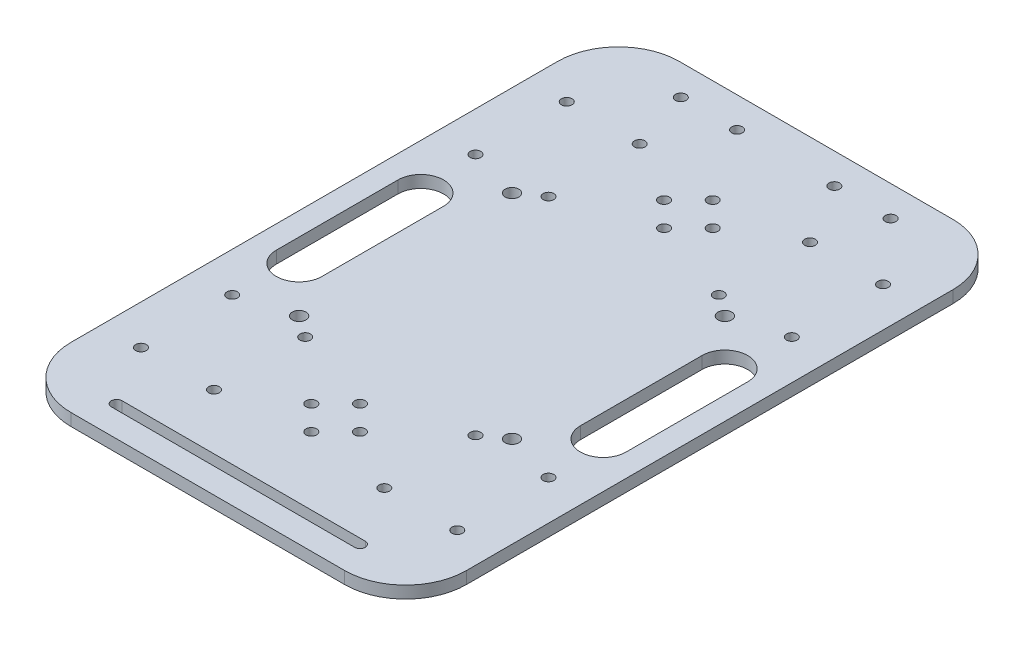
from build123d import *

# Parameters (mm, degrees)
SKETCH_1_W      = 130
SKETCH_1_H      = 200
SKETCH_1_R      = 1.75
SKETCH_1_R_2    = 2.25
EXTRUDE_2_DEPTH = 4
FILLET_1_R      = 20
FILLET_2_R      = 20
FILLET_3_R      = 20
FILLET_4_R      = 20


with BuildPart() as part:
    # 草图1 → 凸台-拉伸2 (new body)
    with BuildSketch(Plane(origin=(0, 0, 0), x_dir=(1, 0, 0), z_dir=(0, 1, 0))):
        Rectangle(SKETCH_1_W, SKETCH_1_H)
        with Locations((-52, -70)):
            Circle(SKETCH_1_R, mode=Mode.SUBTRACT)
        with Locations((-28, -70)):
            Circle(SKETCH_1_R, mode=Mode.SUBTRACT)
        with Locations((-8, -58)):
            Circle(SKETCH_1_R, mode=Mode.SUBTRACT)
        with Locations((0, -50)):
            Circle(SKETCH_1_R, mode=Mode.SUBTRACT)
        with Locations((-52, -40)):
            Circle(SKETCH_1_R, mode=Mode.SUBTRACT)
        with Locations((-35, -35)):
            Circle(SKETCH_1_R_2, mode=Mode.SUBTRACT)
        with BuildLine():
            ThreePointArc((-42.5, -20), (-50, -27.5), (-57.5, -20))
            Line((-57.5, -20), (-57.5, 20))
            ThreePointArc((-57.5, 20), (-50, 27.5), (-42.5, 20))
            Line((-42.5, 20), (-42.5, -20))
        make_face(mode=Mode.SUBTRACT)
        with Locations((-28, -40)):
            Circle(SKETCH_1_R, mode=Mode.SUBTRACT)
        with BuildLine():
            ThreePointArc((-40, -91.75), (-41.75, -90), (-40, -88.25))
            Line((-40, -88.25), (40, -88.25))
            ThreePointArc((40, -88.25), (41.75, -90), (40, -91.75))
            Line((40, -91.75), (-40, -91.75))
        make_face(mode=Mode.SUBTRACT)
        with Locations((0, -66)):
            Circle(SKETCH_1_R, mode=Mode.SUBTRACT)
        with Locations((8, -58)):
            Circle(SKETCH_1_R, mode=Mode.SUBTRACT)
        with Locations((28, -70)):
            Circle(SKETCH_1_R, mode=Mode.SUBTRACT)
        with Locations((52, -70)):
            Circle(SKETCH_1_R, mode=Mode.SUBTRACT)
        with Locations((28, -40)):
            Circle(SKETCH_1_R, mode=Mode.SUBTRACT)
        with Locations((35, -35)):
            Circle(SKETCH_1_R_2, mode=Mode.SUBTRACT)
        with Locations((52, -40)):
            Circle(SKETCH_1_R, mode=Mode.SUBTRACT)
        with BuildLine():
            ThreePointArc((57.5, -20), (50, -27.5), (42.5, -20))
            Line((42.5, -20), (42.5, 20))
            ThreePointArc((42.5, 20), (50, 27.5), (57.5, 20))
            Line((57.5, 20), (57.5, -20))
        make_face(mode=Mode.SUBTRACT)
        with Locations((-52, 40)):
            Circle(SKETCH_1_R, mode=Mode.SUBTRACT)
        with Locations((-35, 35)):
            Circle(SKETCH_1_R_2, mode=Mode.SUBTRACT)
        with Locations((-28, 40)):
            Circle(SKETCH_1_R, mode=Mode.SUBTRACT)
        with Locations((0, 50)):
            Circle(SKETCH_1_R, mode=Mode.SUBTRACT)
        with Locations((-52, 70)):
            Circle(SKETCH_1_R, mode=Mode.SUBTRACT)
        with Locations((-34.5, 90)):
            Circle(SKETCH_1_R, mode=Mode.SUBTRACT)
        with Locations((-28, 70)):
            Circle(SKETCH_1_R, mode=Mode.SUBTRACT)
        with Locations((-8, 58)):
            Circle(SKETCH_1_R, mode=Mode.SUBTRACT)
        with Locations((0, 66)):
            Circle(SKETCH_1_R, mode=Mode.SUBTRACT)
        with Locations((-16, 90)):
            Circle(SKETCH_1_R, mode=Mode.SUBTRACT)
        with Locations((28, 40)):
            Circle(SKETCH_1_R, mode=Mode.SUBTRACT)
        with Locations((35, 35)):
            Circle(SKETCH_1_R_2, mode=Mode.SUBTRACT)
        with Locations((52, 40)):
            Circle(SKETCH_1_R, mode=Mode.SUBTRACT)
        with Locations((8, 58)):
            Circle(SKETCH_1_R, mode=Mode.SUBTRACT)
        with Locations((28, 70)):
            Circle(SKETCH_1_R, mode=Mode.SUBTRACT)
        with Locations((16, 90)):
            Circle(SKETCH_1_R, mode=Mode.SUBTRACT)
        with Locations((52, 70)):
            Circle(SKETCH_1_R, mode=Mode.SUBTRACT)
        with Locations((34.5, 90)):
            Circle(SKETCH_1_R, mode=Mode.SUBTRACT)
    extrude(amount=EXTRUDE_2_DEPTH)

    # 圆角1
    fillet_1_edges = [part.edges().sort_by_distance(p)[0] for p in [
        (65, 2, 100),
    ]]
    fillet(fillet_1_edges, radius=FILLET_1_R)

    # 圆角2
    fillet_2_edges = [part.edges().sort_by_distance(p)[0] for p in [
        (-65, 2, 100),
    ]]
    fillet(fillet_2_edges, radius=FILLET_2_R)

    # 圆角3
    fillet_3_edges = [part.edges().sort_by_distance(p)[0] for p in [
        (-65, 2, -100),
    ]]
    fillet(fillet_3_edges, radius=FILLET_3_R)

    # 圆角4
    fillet_4_edges = [part.edges().sort_by_distance(p)[0] for p in [
        (65, 2, -100),
    ]]
    fillet(fillet_4_edges, radius=FILLET_4_R)


solid = part.part
